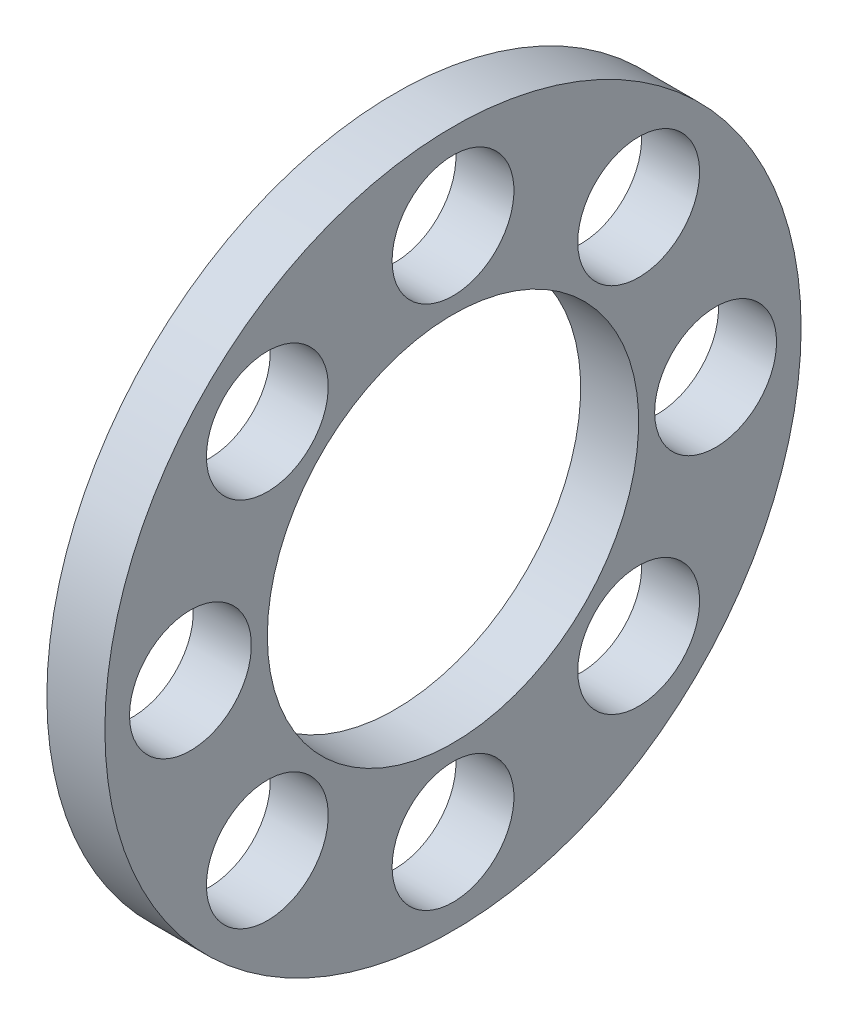
from build123d import *

# Parameters (mm, degrees)
SKETCH7_R           = 15
SKETCH7_R_2         = 2.625
SKETCH7_R_3         = 8
BOSS_EXTRUDE1_DEPTH = 2.5


# Read off the part's stored shape, not the designer's step: 211-0022 (28 Tooth Bevel Gear).STEP<1>
with BuildPart() as part:
    # Sketch7 → Boss-Extrude1 (new body)
    with BuildSketch(Plane.ZY.offset(-1.3887)):
        Circle(SKETCH7_R)
        with Locations((-8, 8)):
            Circle(SKETCH7_R_2, mode=Mode.SUBTRACT)
        with Locations((-11.313708499, 0)):
            Circle(SKETCH7_R_2, mode=Mode.SUBTRACT)
        with Locations((-8, -8)):
            Circle(SKETCH7_R_2, mode=Mode.SUBTRACT)
        with Locations((0, -11.313708499)):
            Circle(SKETCH7_R_2, mode=Mode.SUBTRACT)
        with Locations((8, -8)):
            Circle(SKETCH7_R_2, mode=Mode.SUBTRACT)
        with Locations((11.313708499, 0)):
            Circle(SKETCH7_R_2, mode=Mode.SUBTRACT)
        with Locations((8, 8)):
            Circle(SKETCH7_R_2, mode=Mode.SUBTRACT)
        with Locations((0, 11.313708499)):
            Circle(SKETCH7_R_2, mode=Mode.SUBTRACT)
        Circle(SKETCH7_R_3, mode=Mode.SUBTRACT)
    extrude(amount=BOSS_EXTRUDE1_DEPTH)


solid = part.part
